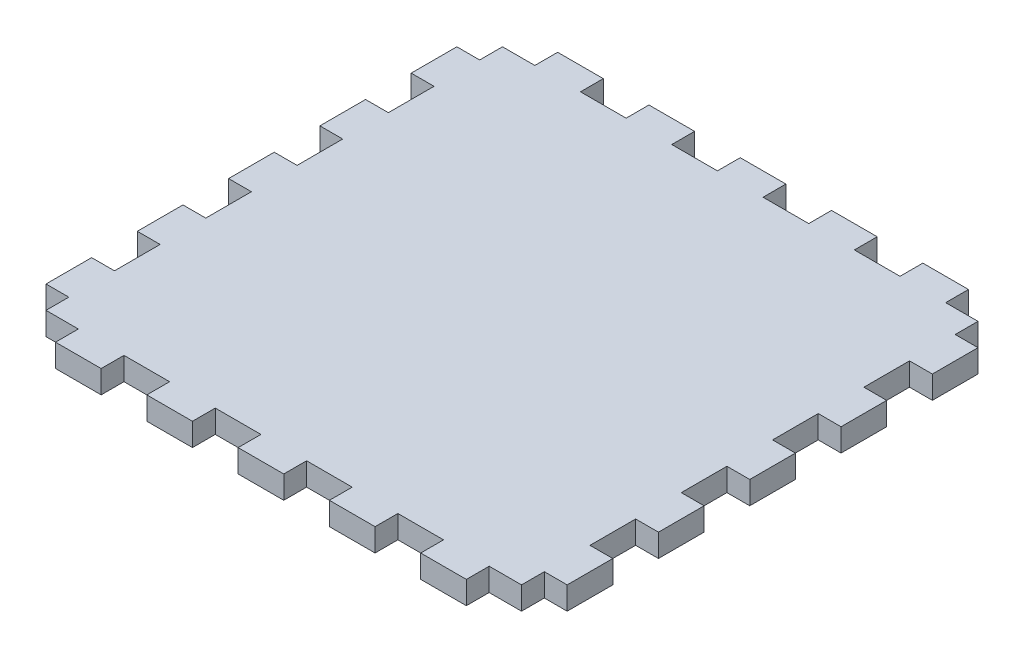
from build123d import *

# Parameters (mm, degrees)
BOSS_EXTRUDE2_DEPTH = 6


with BuildPart() as part:
    # Sketch1 → Boss-Extrude2 (new body)
    with BuildSketch(Plane(origin=(0, 0, 0), x_dir=(1, 0, 0), z_dir=(0, 1, 0))):
        Polygon((-62.5, -54), (-62.5, -60), (-54, -60), (-54, -66), (-42, -66), (-42, -60), (-30, -60), (-30, -66), (-18, -66), (-18, -60), (-6, -60), (-6, -66), (6, -66), (6, -60), (18, -60), (18, -66), (30, -66), (30, -60), (42, -60), (42, -66), (54, -66), (54, -60), (62.5, -60), (62.5, -54), (68.5, -54), (68.5, -42), (62.5, -42), (62.5, -30), (68.5, -30), (68.5, -18), (62.5, -18), (62.5, -6), (68.5, -6), (68.5, 6), (62.5, 6), (62.5, 18), (68.5, 18), (68.5, 30), (62.5, 30), (62.5, 42), (68.5, 42), (68.5, 54), (62.5, 54), (62.5, 60), (54, 60), (54, 66), (42, 66), (42, 60), (30, 60), (30, 66), (18, 66), (18, 60), (6, 60), (6, 66), (-6, 66), (-6, 60), (-18, 60), (-18, 66), (-30, 66), (-30, 60), (-42, 60), (-42, 66), (-54, 66), (-54, 60), (-62.5, 60), (-62.5, 54), (-68.5, 54), (-68.5, 42), (-62.5, 42), (-62.5, 30), (-68.5, 30), (-68.5, 18), (-62.5, 18), (-62.5, 6), (-68.5, 6), (-68.5, -6), (-62.5, -6), (-62.5, -18), (-68.5, -18), (-68.5, -30), (-62.5, -30), (-62.5, -42), (-68.5, -42), (-68.5, -54), align=None)
    extrude(amount=BOSS_EXTRUDE2_DEPTH)


solid = part.part
